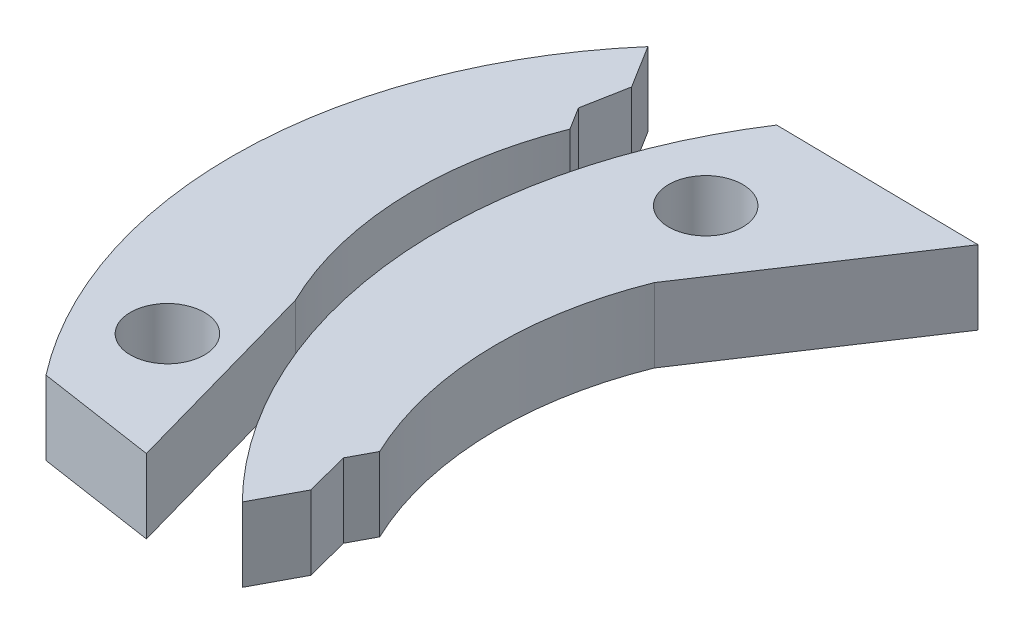
from build123d import *

# Parameters (mm, degrees)
SKETCH2_R             = 1.5
BOSS_EXTRUDE2_DEPTH   = 3
BOSS_EXTRUDE2_2_DEPTH = 3


with BuildPart() as part:
    # Sketch2 → Boss-Extrude2 (new body)
    with BuildSketch(Plane(origin=(0, 3, 0), x_dir=(1, 0, 0), z_dir=(0, 1, 0))):
        with BuildLine():
            Line((-18.472585546, 4.543639245), (-13.240332776, 12.437413009))
            Line((-13.240332776, 12.437413009), (-21.525923441, 12.557634107))
            ThreePointArc((-21.525923441, 12.557634107), (-24.567334483, 0.096986634), (-19.122919896, -11.516637536))
            Line((-19.122919896, -11.516637536), (-18.156988055, -9.704080934))
            Line((-18.156988055, -9.704080934), (-18.620415993, -7.915808503))
            Line((-18.620415993, -7.915808503), (-18.109791275, -6.957628884))
            ThreePointArc((-18.109791275, -6.957628884), (-19.492598284, -1.244891912), (-18.472585546, 4.543639245))
        make_face()
        with Locations((-20.129427181, 8.283032741)):
            Circle(SKETCH2_R, mode=Mode.SUBTRACT)
    extrude(amount=BOSS_EXTRUDE2_DEPTH)


with BuildPart() as body_2:
    # Sketch2 → Boss-Extrude2 2 (new body)
    with BuildSketch(Plane(origin=(0, 3, 0), x_dir=(1, 0, 0), z_dir=(0, 1, 0))):
        with BuildLine():
            Line((-22.76767927, -11.759387372), (-25.134562516, -3.343822659))
            ThreePointArc((-25.134562516, -3.343822659), (-26.572317612, 2.395228375), (-25.576075192, 8.22715323))
            Line((-25.576075192, 8.22715323), (-26.145959486, 9.141062093))
            Line((-26.145959486, 9.141062093), (-25.805002849, 10.956670066))
            Line((-25.805002849, 10.956670066), (-26.891756991, 12.699469879))
            ThreePointArc((-26.891756991, 12.699469879), (-31.463807212, 0.948210591), (-27.557876381, -11.040927929))
            Line((-27.557876381, -11.040927929), (-22.76767927, -11.759387372))
        make_face()
        with Locations((-26.55178318, -7.122851322)):
            Circle(SKETCH2_R, mode=Mode.SUBTRACT)
    extrude(amount=BOSS_EXTRUDE2_2_DEPTH)


solid = Compound([part.part, body_2.part])
